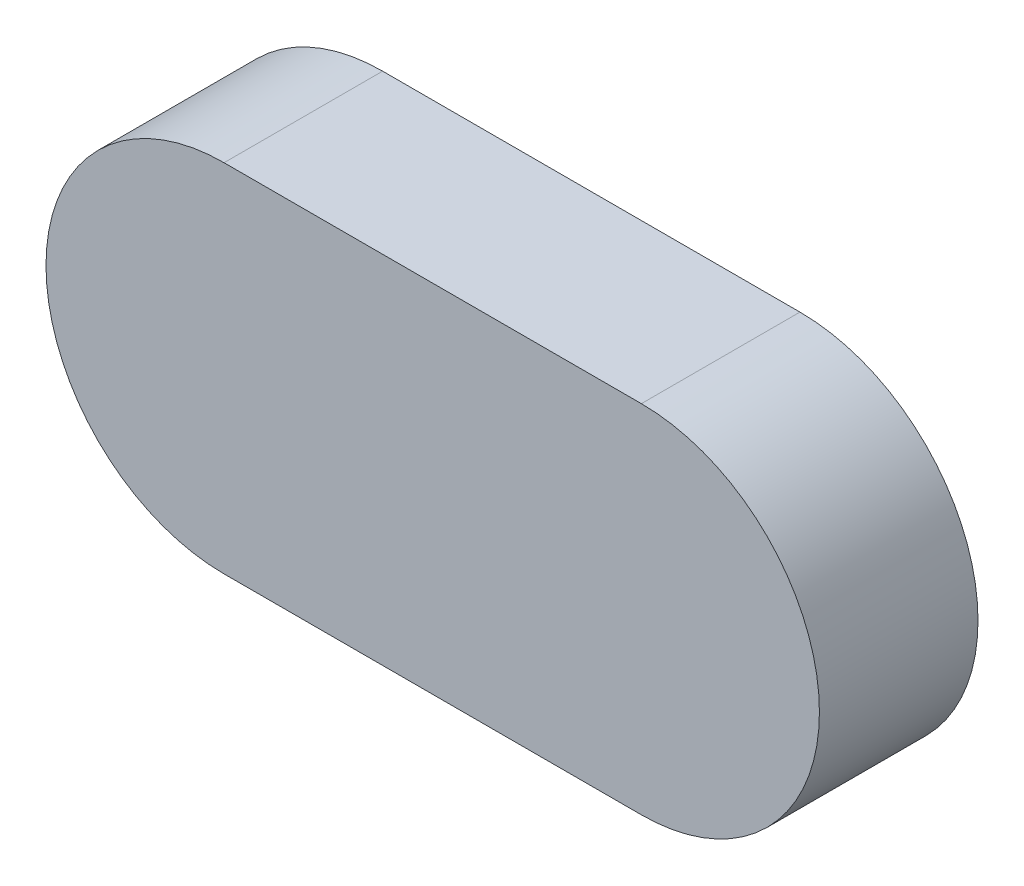
from build123d import *

# Parameters (mm, degrees)
BOSS_EXTRUDE1_DEPTH = 57
SKETCH3_R           = 54
CUT_EXTRUDE1_DEPTH  = 42
CUT_EXTRUDE2_DEPTH  = 10


with BuildPart() as part:
    # Sketch2 → Boss-Extrude1 (new body)
    with BuildSketch(Plane.XY):
        with BuildLine():
            Line((150, 64), (0, 64))
            ThreePointArc((0, 64), (-64, 0), (0, -64))
            Line((0, -64), (150, -64))
            ThreePointArc((150, -64), (214, 0), (150, 64))
        make_face()
    extrude(amount=-BOSS_EXTRUDE1_DEPTH)

    # Sketch3 → Cut-Extrude1 (cut)
    with BuildSketch(Plane(origin=(0, 0, -57), x_dir=(-1, 0, 0), z_dir=(0, 0, -1))):
        Circle(SKETCH3_R)
        with Locations((-150, 0)):
            Circle(SKETCH3_R)
    extrude(amount=-CUT_EXTRUDE1_DEPTH, mode=Mode.SUBTRACT)

    # Sketch4 → Cut-Extrude2 (cut)
    with BuildSketch(Plane(origin=(0, 0, -15), x_dir=(-1, 0, 0), z_dir=(0, 0, -1))):
        with BuildLine():
            Line((-180, -26.25), (-180, 26.25))
            ThreePointArc((-180, 26.25), (-178.901650429, 28.901650429), (-176.25, 30))
            Line((-176.25, 30), (-123.75, 30))
            ThreePointArc((-123.75, 30), (-121.098349571, 28.901650429), (-120, 26.25))
            Line((-120, 26.25), (-120, -26.25))
            ThreePointArc((-120, -26.25), (-121.098349571, -28.901650429), (-123.75, -30))
            Line((-123.75, -30), (-176.25, -30))
            ThreePointArc((-176.25, -30), (-178.901650429, -28.901650429), (-180, -26.25))
        make_face()
        with BuildLine():
            Line((-26.25, -30), (26.25, -30))
            ThreePointArc((26.25, -30), (28.901650429, -28.901650429), (30, -26.25))
            Line((30, -26.25), (30, 26.25))
            ThreePointArc((30, 26.25), (28.901650429, 28.901650429), (26.25, 30))
            Line((26.25, 30), (-26.25, 30))
            ThreePointArc((-26.25, 30), (-28.901650429, 28.901650429), (-30, 26.25))
            Line((-30, 26.25), (-30, -26.25))
            ThreePointArc((-30, -26.25), (-28.901650429, -28.901650429), (-26.25, -30))
        make_face()
    extrude(amount=-CUT_EXTRUDE2_DEPTH, mode=Mode.SUBTRACT)


solid = part.part
